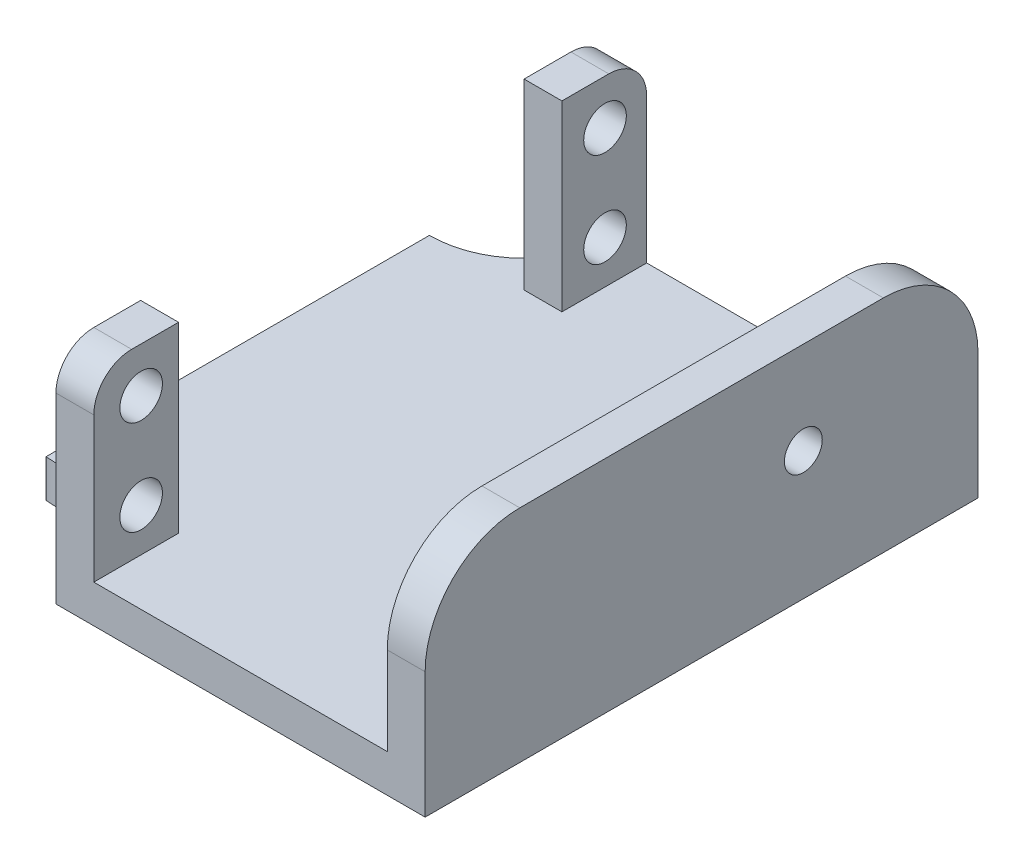
from build123d import *

# Parameters (mm, degrees)
BOSS_EXTRUDE1_DEPTH = 4
SKETCH2_W           = 8.95
SKETCH2_H           = 19.3
SKETCH2_R           = 2.25
BOSS_EXTRUDE2_DEPTH = 4
FILLET1_R           = 10
FILLET2_R           = 4
SKETCH3_W           = 58.4
SKETCH3_H           = 19.3
SKETCH3_R           = 2
BOSS_EXTRUDE3_DEPTH = 4
FILLET3_R           = 10


with BuildPart() as part:
    # Sketch1 → Boss-Extrude1 (new body)
    with BuildSketch(Plane(origin=(0, 0, 0), x_dir=(1, 0, 0), z_dir=(0, 1, 0))):
        Polygon((-49, 49.45), (-39, 49.45), (-39, 58.4), (0, 58.4), (0, 0), (-39, 0), (-39, 8.95), (-49, 8.95), align=None)
    extrude(amount=BOSS_EXTRUDE1_DEPTH)

    # Sketch2 → Boss-Extrude2 (add)
    # profile 1 of 2: a face of its own
    with BuildSketch(Plane.ZY.offset(39)):
        with Locations((-4.475, 13.65)):
            Rectangle(SKETCH2_W, SKETCH2_H)
        with Locations((-5, 18.55)):
            Circle(SKETCH2_R, mode=Mode.SUBTRACT)
        with Locations((-5, 8.55)):
            Circle(SKETCH2_R, mode=Mode.SUBTRACT)
    # profile 2 of 2: a face of its own
    with BuildSketch(Plane.ZY.offset(39)):
        with Locations((-53.925, 13.65)):
            Rectangle(SKETCH2_W, SKETCH2_H)
        with Locations((-54, 18.55)):
            Circle(SKETCH2_R, mode=Mode.SUBTRACT)
        with Locations((-54, 8.55)):
            Circle(SKETCH2_R, mode=Mode.SUBTRACT)
    extrude(amount=-BOSS_EXTRUDE2_DEPTH)

    # Fillet1
    # the kernel refuses this fillet: 10 mm, written as the material it adds along each edge
    with BuildSketch(Plane(origin=(-39, 0, -49.45), x_dir=(-1, 0, 0), z_dir=(0, 1, 0))) as fillet1_piece_1:
        with BuildLine():
            CenterArc((9.944722218, -10), FILLET1_R, 90, 83.97283344)
            Line((0, -8.95), (0, 0))
            Line((0, 0), (9.944722218, 0))
        make_face()
    extrude(amount=4)
    with BuildSketch(Plane(origin=(-39, 0, -8.95), x_dir=(0, 0, 1), z_dir=(0, 1, 0))) as fillet1_piece_2:
        with BuildLine():
            CenterArc((10, -9.944722218), FILLET1_R, 96.02716656, 83.97283344)
            Line((0, -9.944722218), (0, 0))
            Line((0, 0), (8.95, 0))
        make_face()
    extrude(amount=4)

    # Fillet2
    fillet2_edges = [part.edges().sort_by_distance(p)[0] for p in [
        (-37, 23.3, 0),
        (-37, 23.3, -58.4),
    ]]
    fillet(fillet2_edges, radius=FILLET2_R)

    # Sketch3 → Boss-Extrude3 (add)
    with BuildSketch(Plane(origin=(0, 0, 0), x_dir=(0, 0, -1), z_dir=(1, 0, 0))):
        with Locations((29.2, 13.65)):
            Rectangle(SKETCH3_W, SKETCH3_H)
        with Locations((39.95, 13.55)):
            Circle(SKETCH3_R, mode=Mode.SUBTRACT)
    extrude(amount=-BOSS_EXTRUDE3_DEPTH)

    # Fillet3
    fillet3_edges = [part.edges().sort_by_distance(p)[0] for p in [
        (-2, 23.3, 0),
        (-2, 23.3, -58.4),
    ]]
    fillet(fillet3_edges, radius=FILLET3_R)


solid = part.part
